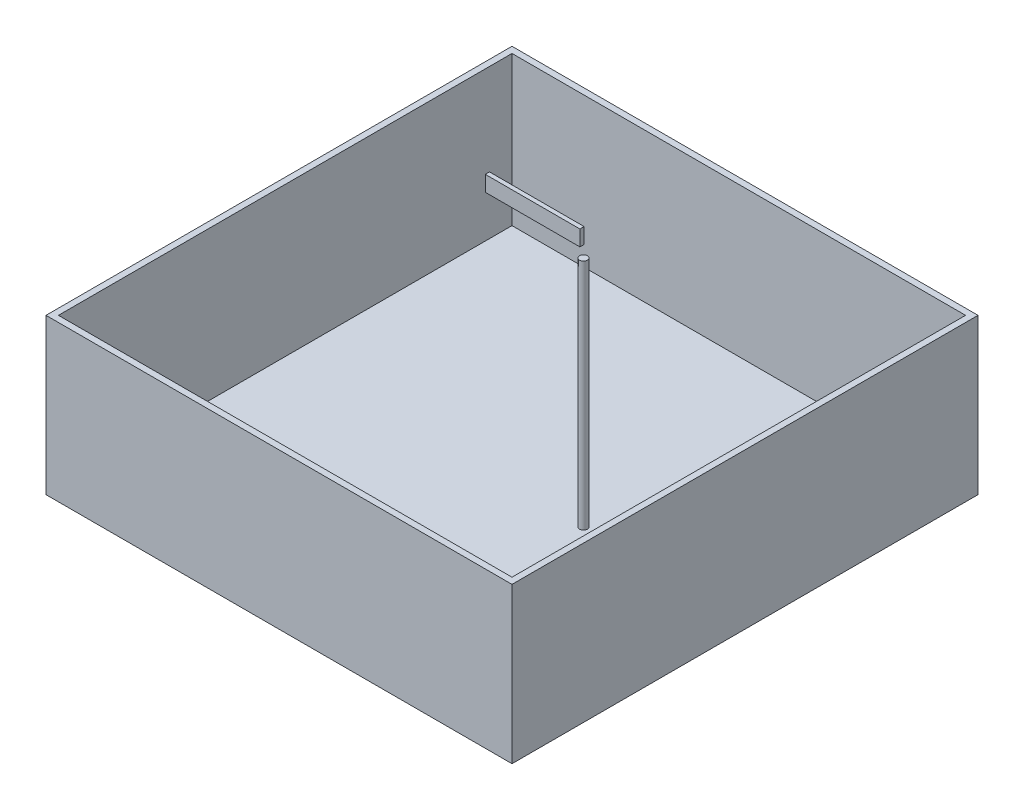
from build123d import *

# Parameters (mm, degrees)
CROQUIS1_W                   = 40
CROQUIS1_H                   = 40
SALIENTE_EXTRUIR1_DEPTH      = 0.3
SALIENTE_EXTRUIR2_DEPTH      = 10
SALIENTE_EXTRUIR2_DEPTH_BACK = 10
CROQUIS2_R                   = 2.5
CORTAR_EXTRUIR1_DEPTH        = 2.5
CORTAR_EXTRUIR1_DEPTH_BACK   = 2.5
CROQUIS3_W                   = 14.056155144
CROQUIS3_H                   = 12
CROQUIS4_W                   = 300
CROQUIS4_H                   = 100
SALIENTE_EXTRUIR3_DEPTH      = 300
VACIADO2_START               = 4.3
VACIADO2_OUTLINE_W           = 292
VACIADO2_OUTLINE_H           = 96
VACIADO2_DEPTH               = 292
VACIADO2_START_2             = 4
VACIADO2_2_OUTLINE_W         = 32
VACIADO2_2_OUTLINE_H         = 32
VACIADO2_2_DEPTH             = 0.3
VACIADO2_3_OUTLINE_W         = 2
VACIADO2_3_OUTLINE_H         = 12
VACIADO2_3_DEPTH             = 4
CROQUIS6_W                   = 32
CROQUIS6_H                   = 32
SALIENTE_EXTRUIR4_DEPTH      = 0.3
CROQUIS7_R                   = 2.5
SALIENTE_EXTRUIR5_DEPTH      = 150
CROQUIS8_W                   = 60.937965474
CROQUIS8_H                   = 2.7059869
SALIENTE_EXTRUIR6_DEPTH      = 10


# Read off the part's stored shape, not the designer's step: Vaciado2
with BuildPart() as part:
    # Croquis1 → Saliente-Extruir1 (new body)
    with BuildSketch(Plane.XY):
        Rectangle(CROQUIS1_W, CROQUIS1_H)
    extrude(amount=SALIENTE_EXTRUIR1_DEPTH)

    # Croquis2 → Saliente-Extruir2 (add, two sides: drawn at the far end of the back side and taken through both)
    with BuildSketch(Plane(origin=(0, 0, 0), x_dir=(1, 0, 0), z_dir=(0, 1, 0)).offset(-SALIENTE_EXTRUIR2_DEPTH_BACK)):
        with BuildLine():
            Line((-5, 10), (-5, 0))
            Line((-5, 0), (5, 0))
            Line((5, 0), (5, 10))
            ThreePointArc((5, 10), (0, 15), (-5, 10))
        make_face()
        with Locations(Location((0, 10, 0), (0, 0, 270))):
            Circle(CROQUIS2_R, mode=Mode.SUBTRACT)
    extrude(amount=SALIENTE_EXTRUIR2_DEPTH + SALIENTE_EXTRUIR2_DEPTH_BACK)

    # Croquis3 → Cortar-Extruir1 (cut, two sides: drawn at the far end of the back side and taken through both)
    with BuildSketch(Plane(origin=(0, 0, 0), x_dir=(1, 0, 0), z_dir=(0, 1, 0)).offset(-CORTAR_EXTRUIR1_DEPTH_BACK)):
        with Locations((0, 10)):
            Rectangle(CROQUIS3_W, CROQUIS3_H)
    extrude(amount=CORTAR_EXTRUIR1_DEPTH + CORTAR_EXTRUIR1_DEPTH_BACK, mode=Mode.SUBTRACT)

    # Croquis4 → Saliente-Extruir3 (add)
    with BuildSketch(Plane.XY.offset(0.3)):
        Rectangle(CROQUIS4_W, CROQUIS4_H)
    extrude(amount=SALIENTE_EXTRUIR3_DEPTH)

    # Vaciado2 outline → Vaciado2 (cut)
    with BuildSketch(Plane.XY.offset(VACIADO2_START)):
        with Locations((0, 2)):
            Rectangle(VACIADO2_OUTLINE_W, VACIADO2_OUTLINE_H)
    extrude(amount=VACIADO2_DEPTH, mode=Mode.SUBTRACT)

    # Vaciado2 2 outline → Vaciado2 2 (cut)
    with BuildSketch(Plane.XY.offset(VACIADO2_START_2)):
        Rectangle(VACIADO2_2_OUTLINE_W, VACIADO2_2_OUTLINE_H)
    extrude(amount=VACIADO2_2_DEPTH, mode=Mode.SUBTRACT)

    # Vaciado2 3 outline → Vaciado2 3 (cut)
    with BuildSketch(Plane.XY):
        Rectangle(VACIADO2_3_OUTLINE_W, VACIADO2_3_OUTLINE_H)
    extrude(amount=VACIADO2_3_DEPTH, mode=Mode.SUBTRACT)

    # Croquis6 → Saliente-Extruir4 (add)
    with BuildSketch(Plane.XY.offset(4)):
        Rectangle(CROQUIS6_W, CROQUIS6_H)
    extrude(amount=SALIENTE_EXTRUIR4_DEPTH)

    # Croquis7 → Saliente-Extruir5 (add)
    with BuildSketch(Plane(origin=(0, -46, 0), x_dir=(1, 0, 0), z_dir=(0, 1, 0))):
        with Locations(Location((45, -149.3, 0), (0, 0, 270))):
            Circle(CROQUIS7_R)
    extrude(amount=SALIENTE_EXTRUIR5_DEPTH)


with BuildPart() as body_2:
    # Croquis8 → Saliente-Extruir6 (new body)
    with BuildSketch(Plane(origin=(0, 104, 0), x_dir=(1, 0, 0), z_dir=(0, 1, 0))):
        with Locations((7.266795091, -142.94700655)):
            Rectangle(CROQUIS8_W, CROQUIS8_H)
    extrude(amount=SALIENTE_EXTRUIR6_DEPTH)


solid = Compound([part.part, body_2.part])
